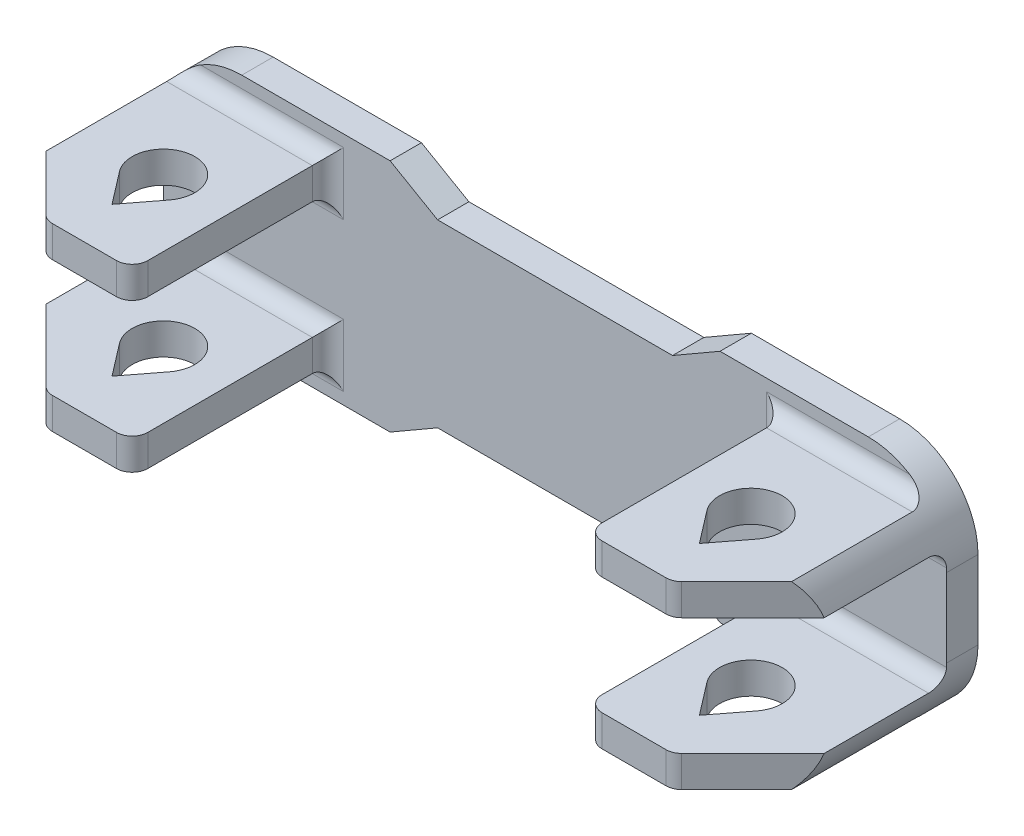
from build123d import *

# Parameters (mm, degrees)
SKETCH1_W                = 100
SKETCH1_H                = 30
BOSS_EXTRUDE1_DEPTH      = 4
SKETCH2_W                = 21
SKETCH2_H                = 4
BOSS_EXTRUDE2_DEPTH      = 25
CHAMFER1_SIZE            = 10
CHAMFER1_OF_MIRROR1_SIZE = 10
MIRROR2_START            = -11.5
MIRROR2_DEPTH            = 4
MIRROR2_START_2          = 7.5
MIRROR2_2_DEPTH          = 4
CUT_EXTRUDE1_DEPTH       = 64.586555183
FILLET1_R                = 10
FILLET2_R                = 2
CUT_EXTRUDE2_DEPTH       = 58.879184626


# Read off the part's stored shape, not the designer's step: Mirror2
with BuildPart() as part:
    # Sketch1 → Boss-Extrude1 (new body)
    with BuildSketch(Plane.XY):
        Rectangle(SKETCH1_W, SKETCH1_H)
    extrude(amount=BOSS_EXTRUDE1_DEPTH)

    # Sketch2 → Boss-Extrude2 (add)
    with BuildSketch(Plane.XY.offset(4)):
        with Locations((-39.5, -9.5)):
            Rectangle(SKETCH2_W, SKETCH2_H)
    boss_extrude2 = extrude(amount=BOSS_EXTRUDE2_DEPTH)

    # Chamfer1
    chamfer1_edges = [part.edges().sort_by_distance(p)[0] for p in [
        (-50, -9.5, 29),
    ]]
    chamfer(chamfer1_edges, length=CHAMFER1_SIZE)

    # Mirror1: Boss-Extrude2 across plane
    add(boss_extrude2.mirror(Plane.ZX))

    # Chamfer1 of Mirror1
    chamfer1_of_mirror1_edges = [part.edges().sort_by_distance(p)[0] for p in [
        (-50, 9.5, 29),
    ]]
    chamfer(chamfer1_of_mirror1_edges, length=CHAMFER1_OF_MIRROR1_SIZE)

    # Mirror2 outline → Mirror2 (add)
    with BuildSketch(Plane(origin=(0, 0, 0), x_dir=(1, 0, 0), z_dir=(0, 1, 0)).offset(MIRROR2_START)):
        Polygon((50, -19), (50, -4), (29, -4), (29, -29), (40, -29), align=None)
    extrude(amount=MIRROR2_DEPTH)

    # Mirror2 2 outline → Mirror2 2 (add)
    with BuildSketch(Plane(origin=(0, 0, 0), x_dir=(1, 0, 0), z_dir=(0, 1, 0)).offset(MIRROR2_START_2)):
        Polygon((50, -19), (50, -4), (29, -4), (29, -29), (40, -29), align=None)
    extrude(amount=MIRROR2_2_DEPTH)

    # Sketch3 → Cut-Extrude1 (cut, through all)
    with BuildSketch(Plane.XZ.offset(11.5)):
        with BuildLine():
            Line((-40.673413361, 18.935045716), (-37.5, 23.070718527))
            Line((-37.5, 23.070718527), (-34.326586639, 18.935045716))
            ThreePointArc((-34.326586639, 18.935045716), (-37.5, 12.5), (-40.673413361, 18.935045716))
        make_face()
    cut_extrude1 = extrude(amount=-CUT_EXTRUDE1_DEPTH, mode=Mode.SUBTRACT)

    # Mirror4: Cut-Extrude1 across plane
    add(cut_extrude1.mirror(Plane(origin=(0, 0, 0), x_dir=(0, 0, 1), z_dir=(1, 0, 0))), mode=Mode.SUBTRACT)

    # Fillet1
    # the kernel refuses this fillet: 10 mm, written as the material it takes off along each edge
    with BuildSketch(Plane(origin=(50, 15, -25), x_dir=(-1, 0, 0), z_dir=(0, 0, 1)), Plane(origin=(-50, 15, -25), x_dir=(0, -1, 0), z_dir=(0, 0, 1))) as fillet1_piece_1:
        with BuildLine():
            CenterArc((FILLET1_R, FILLET1_R), FILLET1_R, 180, 90)
            Line((0, FILLET1_R), (0, 0))
            Line((0, 0), (FILLET1_R, 0))
        make_face()
    extrude(amount=54, mode=Mode.SUBTRACT)
    with BuildSketch(Plane(origin=(50, -15, -25), x_dir=(-1, 0, 0), z_dir=(0, 0, 1)), Plane(origin=(-50, -15, -25), x_dir=(0, 1, 0), z_dir=(0, 0, 1))) as fillet1_piece_2:
        with BuildLine():
            CenterArc((FILLET1_R, -FILLET1_R), FILLET1_R, 90, 90)
            Line((0, -FILLET1_R), (0, 0))
            Line((0, 0), (FILLET1_R, 0))
        make_face()
    extrude(amount=54, mode=Mode.SUBTRACT)

    # Fillet2
    fillet2_edges = [part.edges().sort_by_distance(p)[0] for p in [
        (38.299671038, 11.5, 4),
        (-38.299671038, 11.5, 4),
        (-38.299671038, -11.5, 4),
        (38.299671038, -11.5, 4),
        (-29, -9.5, 4),
        (-39.341229183, -7.5, 4),
        (-29, -9.5, 29),
        (-40, -9.5, 29),
        (-29, 9.5, 29),
        (-29, 9.5, 4),
        (-39.341229183, 7.5, 4),
        (-40, 9.5, 29),
        (29, 9.5, 4),
        (39.341229183, 7.5, 4),
        (29, 9.5, 29),
        (40, 9.5, 29),
        (29, -9.5, 29),
        (29, -9.5, 4),
        (39.341229183, -7.5, 4),
        (40, -9.5, 29),
    ]]
    fillet(fillet2_edges, radius=FILLET2_R)

    # Sketch4 → Cut-Extrude2 (cut, through all)
    with BuildSketch(Plane.XY.offset(4)):
        Polygon((-15, 15), (15, 15), (21.062177826, 15), (15, 11.5), (-15, 11.5), (-21.062177826, 15), align=None)
    cut_extrude2 = extrude(amount=-CUT_EXTRUDE2_DEPTH, mode=Mode.SUBTRACT)

    # Mirror5: Cut-Extrude2 across plane
    add(cut_extrude2.mirror(Plane.ZX), mode=Mode.SUBTRACT)


solid = part.part
